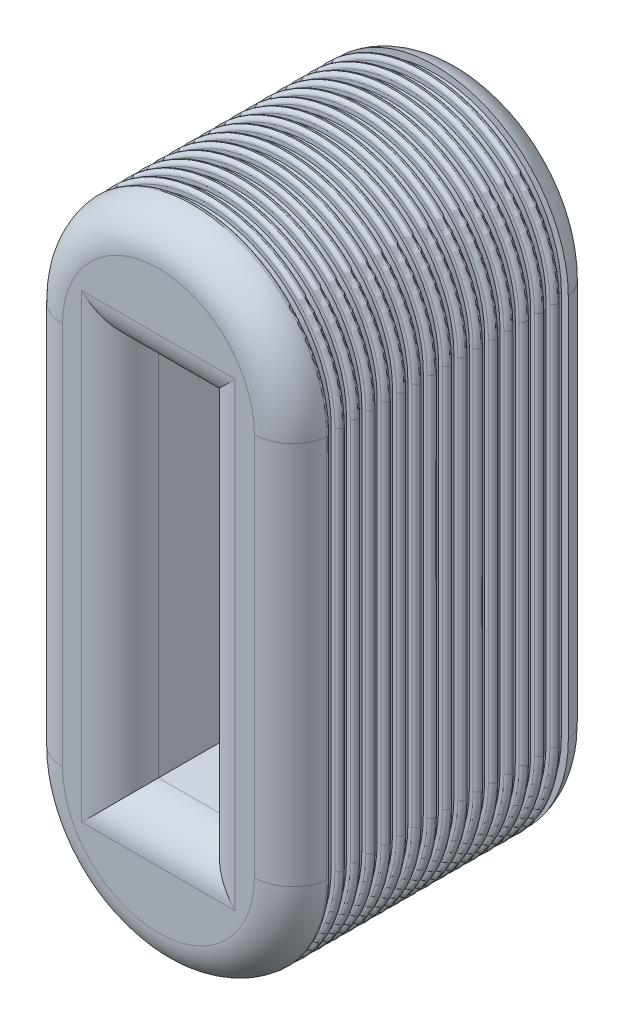
from build123d import *

# Parameters (mm, degrees)
SKETCH1_W             = 1
SKETCH1_H             = 5
WINDING_PROFILE_DEPTH = 4
FILLET1_R             = 0.5
CUT_EXTRUDE1_START    = 0.1
CUT_EXTRUDE1_DEPTH    = 0.1
LPATTERN1_COUNT       = 16
LPATTERN1_PITCH       = 0.2
FILLET3_R             = 0.05


with BuildPart() as part:
    # Sketch1 → Winding profile (new body)
    with BuildSketch(Plane.XY):
        with BuildLine():
            Line((1.75, 2.5), (1.75, -2.5))
            ThreePointArc((1.75, -2.5), (0, -4.25), (-1.75, -2.5))
            Line((-1.75, -2.5), (-1.75, 2.5))
            ThreePointArc((-1.75, 2.5), (0, 4.25), (1.75, 2.5))
        make_face()
        Rectangle(SKETCH1_W, SKETCH1_H, mode=Mode.SUBTRACT)
    extrude(amount=WINDING_PROFILE_DEPTH)

    # Fillet1
    fillet1_edges = [part.edges().sort_by_distance(p)[0] for p in [
        (0, -4.25, 4),
        (1.75, 0, 4),
        (0.5, 0, 0),
        (0, 2.5, 0),
        (-0.5, 0, 0),
        (0, -2.5, 0),
        (0.5, 0, 4),
        (0, 2.5, 4),
        (-0.5, 0, 4),
        (0, -2.5, 4),
        (0, 4.25, 4),
        (1.75, 0, 0),
        (0, -4.25, 0),
        (-1.75, 0, 0),
        (0, 4.25, 0),
        (-1.75, 0, 4),
    ]]
    fillet(fillet1_edges, radius=FILLET1_R)

    # Sketch2 → Cut-Extrude1 (cut)
    with BuildSketch(Plane(origin=(0, 0, 3.5), x_dir=(-1, 0, 0), z_dir=(0, 0, -1)).offset(CUT_EXTRUDE1_START)):
        with BuildLine():
            Line((1.75, -2.5), (1.75, 2.5))
            ThreePointArc((1.75, 2.5), (0, 4.25), (-1.75, 2.5))
            Line((-1.75, 2.5), (-1.75, -2.5))
            ThreePointArc((-1.75, -2.5), (0, -4.25), (1.75, -2.5))
        make_face()
        with BuildLine():
            Line((-1.65, 2.5), (-1.65, -2.5))
            ThreePointArc((-1.65, -2.5), (0, -4.15), (1.65, -2.5))
            Line((1.65, -2.5), (1.65, 2.5))
            ThreePointArc((1.65, 2.5), (0, 4.15), (-1.65, 2.5))
        make_face(mode=Mode.SUBTRACT)
    cut_extrude1 = extrude(amount=-CUT_EXTRUDE1_DEPTH, mode=Mode.SUBTRACT)

    # LPattern1: Cut-Extrude1 ×16
    with Locations(*[(0, 0, -i * LPATTERN1_PITCH) for i in range(1, LPATTERN1_COUNT)]):
        add(cut_extrude1, mode=Mode.SUBTRACT)

    # Fillet3
    fillet3_edges = [part.edges().sort_by_distance(p)[0] for p in [
        (-1.65, 0, 0.5),
        (0, -4.15, 0.5),
        (1.65, 0, 0.5),
        (1.75, 0, 0.5),
        (0, -4.25, 0.5),
        (-1.75, 0, 0.5),
        (-1.75, 0, 0.6),
        (0, -4.25, 0.6),
        (1.75, 0, 0.6),
        (-1.75, 0, 0.7),
        (0, -4.25, 0.7),
        (1.75, 0, 0.7),
        (-1.75, 0, 0.8),
        (0, -4.25, 0.8),
        (1.75, 0, 0.8),
        (-1.75, 0, 0.9),
        (0, -4.25, 0.9),
        (1.75, 0, 0.9),
        (-1.75, 0, 1),
        (0, -4.25, 1),
        (1.75, 0, 1),
        (-1.75, 0, 1.1),
        (0, -4.25, 1.1),
        (1.75, 0, 1.1),
        (-1.75, 0, 1.2),
        (0, -4.25, 1.2),
        (1.75, 0, 1.2),
        (-1.75, 0, 1.3),
        (0, -4.25, 1.3),
        (1.75, 0, 1.3),
        (-1.75, 0, 1.4),
        (0, -4.25, 1.4),
        (1.75, 0, 1.4),
        (-1.75, 0, 1.5),
        (0, -4.25, 1.5),
        (1.75, 0, 1.5),
        (-1.75, 0, 1.6),
        (0, -4.25, 1.6),
        (1.75, 0, 1.6),
        (-1.75, 0, 1.7),
        (0, -4.25, 1.7),
        (1.75, 0, 1.7),
        (-1.75, 0, 1.8),
        (0, -4.25, 1.8),
        (1.75, 0, 1.8),
        (-1.75, 0, 1.9),
        (0, -4.25, 1.9),
        (1.75, 0, 1.9),
        (-1.75, 0, 2),
        (0, -4.25, 2),
        (1.75, 0, 2),
        (-1.75, 0, 2.1),
        (0, -4.25, 2.1),
        (1.75, 0, 2.1),
        (-1.75, 0, 2.2),
        (0, -4.25, 2.2),
        (1.75, 0, 2.2),
        (-1.75, 0, 2.3),
        (0, -4.25, 2.3),
        (1.75, 0, 2.3),
        (-1.75, 0, 2.4),
        (0, -4.25, 2.4),
        (1.75, 0, 2.4),
        (-1.75, 0, 2.5),
        (0, -4.25, 2.5),
        (1.75, 0, 2.5),
        (-1.75, 0, 2.6),
        (0, -4.25, 2.6),
        (1.75, 0, 2.6),
        (-1.75, 0, 2.7),
        (0, -4.25, 2.7),
        (1.75, 0, 2.7),
        (-1.75, 0, 2.8),
        (0, -4.25, 2.8),
        (1.75, 0, 2.8),
        (-1.75, 0, 2.9),
        (0, -4.25, 2.9),
        (1.75, 0, 2.9),
        (-1.75, 0, 3),
        (0, -4.25, 3),
        (1.75, 0, 3),
        (-1.75, 0, 3.1),
        (0, -4.25, 3.1),
        (1.75, 0, 3.1),
        (-1.75, 0, 3.2),
        (0, -4.25, 3.2),
        (1.75, 0, 3.2),
        (-1.75, 0, 3.3),
        (0, -4.25, 3.3),
        (1.75, 0, 3.3),
        (-1.75, 0, 3.4),
        (0, -4.25, 3.4),
        (1.75, 0, 3.4),
        (-1.75, 0, 3.5),
        (0, -4.25, 3.5),
        (1.75, 0, 3.5),
        (0, 4.15, 0.5),
        (0, 4.25, 0.5),
        (0, 4.25, 0.6),
        (0, 4.25, 0.7),
        (0, 4.25, 0.8),
        (0, 4.25, 0.9),
        (0, 4.25, 1),
        (0, 4.25, 1.1),
        (0, 4.25, 1.2),
        (0, 4.25, 1.3),
        (0, 4.25, 1.4),
        (0, 4.25, 1.5),
        (0, 4.25, 1.6),
        (0, 4.25, 1.7),
        (0, 4.25, 1.8),
        (0, 4.25, 1.9),
        (0, 4.25, 2),
        (0, 4.25, 2.1),
        (0, 4.25, 2.2),
        (0, 4.25, 2.3),
        (0, 4.25, 2.4),
        (0, 4.25, 2.5),
        (0, 4.25, 2.6),
        (0, 4.25, 2.7),
        (0, 4.25, 2.8),
        (0, 4.25, 2.9),
        (0, 4.25, 3),
        (0, 4.25, 3.1),
        (0, 4.25, 3.2),
        (0, 4.25, 3.3),
        (0, 4.25, 3.4),
        (0, 4.25, 3.5),
    ]]
    fillet(fillet3_edges, radius=FILLET3_R - 0.0001)  # a hair under: the kernel refuses the full size


solid = part.part
